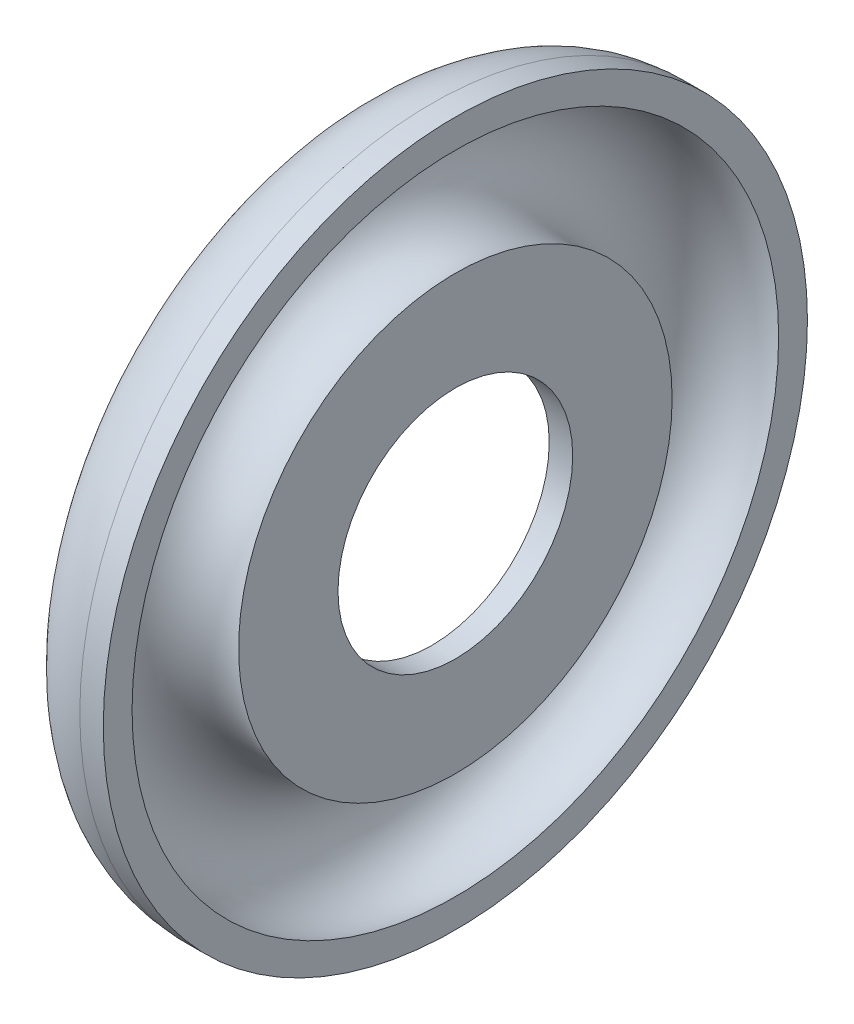
from build123d import *

# Parameters (mm, degrees)
SKETCH_1_R               = 15
EXTRUDE_1_DEPTH          = 1
CUT_EXTRUDE_1_DEPTH      = 22.496695971
CUT_EXTRUDE_1_DEPTH_BACK = 22.496695971
SKETCH_3_R               = 5


# Read off the part's stored shape, not the designer's step: 抽壳1
with BuildPart() as part:
    # 草图1 → 凸台-拉伸1 (new body)
    with BuildSketch(Plane(origin=(0, 0, 0), x_dir=(0, 0, -1), z_dir=(1, 0, 0))):
        Circle(SKETCH_1_R)
    extrude(amount=EXTRUDE_1_DEPTH)

    # 扫描2: sweep along a curve in space
    with BuildLine() as sweep_2_path:
        ThreePointArc((0, 0, -15), (0, 10.606601718, -10.606601718), (0, 15, 0))
        ThreePointArc((0, 15, 0), (0, 10.606601718, 10.606601718), (0, 0, 15))
        ThreePointArc((0, 0, 15), (0, -10.606601718, 10.606601718), (0, -15, 0))
        ThreePointArc((0, -15, 0), (0, -10.606601718, -10.606601718), (0, 0, -15))
    # 草图2 → 扫描2 (sweep)
    with BuildSketch(Plane(origin=(0, 0, 0), x_dir=(1, 0, 0), z_dir=(0, 1, 0))):
        with BuildLine():
            Line((0, 14.984072939), (0, 8.024780741))
            ThreePointArc((0, 8.024780741), (-3.479646099, 11.50442684), (0, 14.984072939))
        make_face()
    sweep(path=sweep_2_path.line)

    # 抽壳1 outline → 抽壳1 (revolve, cut)
    with BuildSketch(Plane.YX):
        with BuildLine():
            ThreePointArc((9.235364307, 1), (11.50442684, -2.479646099), (13.773489373, 1))
            Line((13.773489373, 1), (9.235364307, 1))
        make_face()
    revolve(axis=Axis((0, 0, 0), (1, 0, 0)), mode=Mode.SUBTRACT)

    # 草图3 → 切除-拉伸1 (cut, two sides: drawn at the far end of the back side and taken through both)
    with BuildSketch(Plane.ZY.offset(-CUT_EXTRUDE_1_DEPTH_BACK)):
        Circle(SKETCH_3_R)
    extrude(amount=CUT_EXTRUDE_1_DEPTH + CUT_EXTRUDE_1_DEPTH_BACK, mode=Mode.SUBTRACT)


solid = part.part
